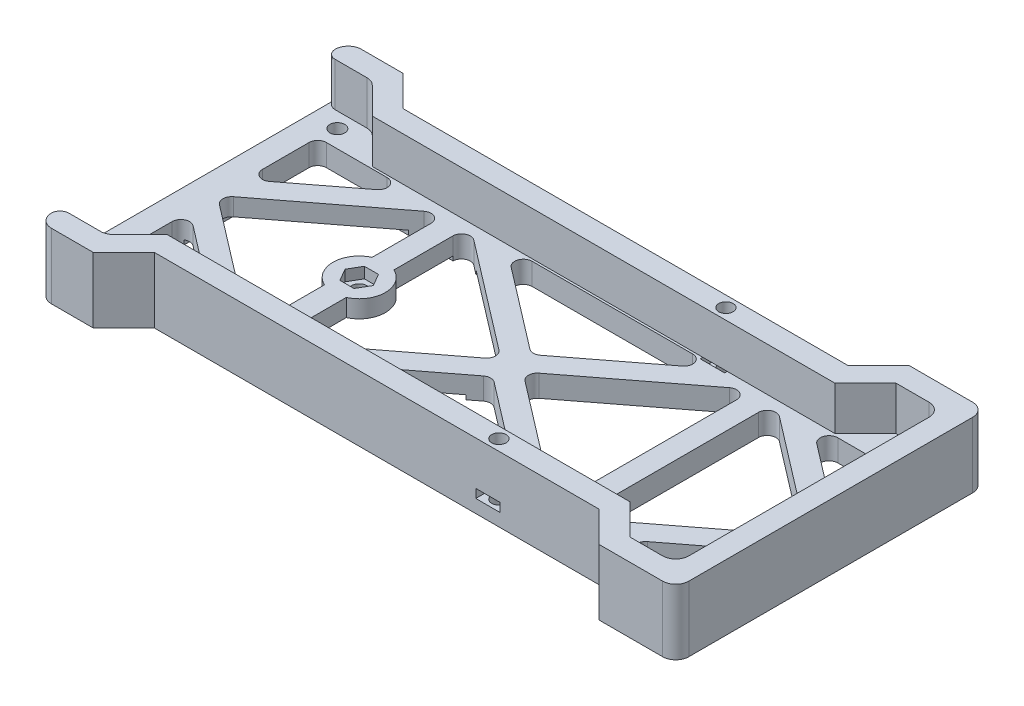
from build123d import *

# Parameters (mm, degrees)
SKETCH1_W                                       = 146
SKETCH1_H                                       = 71
BOSS_EXTRUDE1_DEPTH                             = 15
SHELL1_T                                        = -5
SKETCH2_W                                       = 5
SKETCH2_H                                       = 61
CUT_EXTRUDE1_DEPTH                              = 10
BOSS_EXTRUDE2_DEPTH                             = 10
CSK_FOR_M3_FLAT_HEAD_MACHINE_SCREW1_D           = 3.4
CSK_FOR_M3_FLAT_HEAD_MACHINE_SCREW1_DEPTH       = 10
CSK_FOR_M3_FLAT_HEAD_MACHINE_SCREW1_CSINK_D     = 6.3
CSK_FOR_M3_FLAT_HEAD_MACHINE_SCREW1_CSINK_ANGLE = 90
CSK_FOR_M3_FLAT_HEAD_MACHINE_SCREW1_TIP         = 1.021463052
FILLET1_R                                       = 3
CUT_EXTRUDE3_DEPTH                              = 10
FILLET2_R                                       = 2
SKETCH14_R                                      = 6
BOSS_EXTRUDE4_DEPTH                             = 5
F_3_5_3_5_DIAMETER_HOLE1_D                      = 3.5
CUT_EXTRUDE6_DEPTH                              = 2.5
CUT_EXTRUDE7_DEPTH                              = 10
CUT_EXTRUDE7_DEPTH_BACK                         = 1
SKETCH19_W                                      = 63
SKETCH19_H                                      = 38
CUT_EXTRUDE8_DEPTH                              = 83.54847061
FILLET4_R                                       = 2
FILLET5_R                                       = 3
F_3_3_3_3_DIAMETER_HOLE1_D                      = 3.3
SKETCH24_W                                      = 5.6
SKETCH24_H                                      = 2
CUT_EXTRUDE9_DEPTH                              = 5.6
SKETCH25_W                                      = 5.6
SKETCH25_H                                      = 2
CUT_EXTRUDE10_DEPTH                             = 5.6


with BuildPart() as part:
    # Sketch1 → Boss-Extrude1 (new body)
    with BuildSketch(Plane(origin=(0, 0, 0), x_dir=(1, 0, 0), z_dir=(0, 1, 0))):
        Rectangle(SKETCH1_W, SKETCH1_H)
    extrude(amount=BOSS_EXTRUDE1_DEPTH)

    # Shell1
    shell1_openings = [part.faces().sort_by_distance(p)[0] for p in [
        (0, 15, 0),
    ]]
    offset(amount=SHELL1_T, openings=shell1_openings, kind=Kind.INTERSECTION)

    # Sketch2 → Cut-Extrude1 (cut)
    with BuildSketch(Plane(origin=(0, 15, 0), x_dir=(1, 0, 0), z_dir=(0, 1, 0))):
        with Locations((-70.5, 0)):
            Rectangle(SKETCH2_W, SKETCH2_H)
    extrude(amount=-CUT_EXTRUDE1_DEPTH, mode=Mode.SUBTRACT)

    # Sketch3 → Boss-Extrude2 (add)
    with BuildSketch(Plane(origin=(0, 5, 0), x_dir=(1, 0, 0), z_dir=(0, 1, 0))):
        Polygon((-55.5, 23.5), (50.5, 23.5), (57.5, 30.5), (-62.5, 30.5), align=None)
        Polygon((-55.5, -23.5), (-62.5, -30.5), (57.5, -30.5), (50.5, -23.5), align=None)
    extrude(amount=BOSS_EXTRUDE2_DEPTH)

    # CSK for M3 Flat Head Machine Screw1
    with Locations(Plane(origin=(0, 0, 0), x_dir=(-1, 0, 0), z_dir=(0, -1, 0))):
        with Locations((-63, -27), (67, 27), (67, -27), (-63, 27)):
            CounterSinkHole(CSK_FOR_M3_FLAT_HEAD_MACHINE_SCREW1_D / 2, CSK_FOR_M3_FLAT_HEAD_MACHINE_SCREW1_CSINK_D / 2, depth=CSK_FOR_M3_FLAT_HEAD_MACHINE_SCREW1_DEPTH, counter_sink_angle=CSK_FOR_M3_FLAT_HEAD_MACHINE_SCREW1_CSINK_ANGLE)
            with Locations((0, 0, -(CSK_FOR_M3_FLAT_HEAD_MACHINE_SCREW1_DEPTH + CSK_FOR_M3_FLAT_HEAD_MACHINE_SCREW1_TIP / 2))):  # 118° drill point
                Cone(0, CSK_FOR_M3_FLAT_HEAD_MACHINE_SCREW1_D / 2, CSK_FOR_M3_FLAT_HEAD_MACHINE_SCREW1_TIP, mode=Mode.SUBTRACT)

    # Fillet1
    fillet1_edges = [part.edges().sort_by_distance(p)[0] for p in [
        (-73, 7.5, -35.5),
        (73, 7.5, -35.5),
        (73, 7.5, 35.5),
        (-73, 7.5, 35.5),
    ]]
    fillet(fillet1_edges, radius=FILLET1_R)

    # Sketch8 → Cut-Extrude3 (cut)
    with BuildSketch(Plane.XZ):
        Polygon((67.5, 0), (37.5, 23), (37.5, -23), align=None)
        Polygon((0, 4.383686057), (24.282148621, 23), (-24.282148621, 23), align=None)
        Polygon((2.5, 0), (32.5, -23), (32.5, 23), align=None)
        Polygon((-2.5, 0), (-32.5, 23), (-32.5, -23), align=None)
        Polygon((-67.5, 0), (-37.5, -23), (-37.5, 23), align=None)
        Polygon((-45.717851379, 23), (-67.5, 23), (-67.5, 6.300352724), align=None)
        Polygon((67.5, 6.300352724), (45.717851379, 23), (67.5, 23), align=None)
        Polygon((45.717851379, -23), (67.5, -23), (67.5, -6.300352724), align=None)
        Polygon((-67.5, -6.300352724), (-45.717851379, -23), (-67.5, -23), align=None)
        Polygon((-24.282148621, -23), (24.282148621, -23), (0, -4.383686057), align=None)
    extrude(amount=-CUT_EXTRUDE3_DEPTH, mode=Mode.SUBTRACT)

    # Fillet2
    fillet2_edges = [part.edges().sort_by_distance(p)[0] for p in [
        (-67.5, 2.5, 0),
        (-37.5, 2.5, 23),
        (-37.5, 2.5, -23),
        (0, 2.5, 4.383686057),
        (-24.282148621, 2.5, 23),
        (24.282148621, 2.5, 23),
        (45.717851379, 2.5, -23),
        (67.5, 2.5, -6.300352724),
        (67.5, 2.5, -23),
        (-67.5, 2.5, -23),
        (-67.5, 2.5, -6.300352724),
        (-45.717851379, 2.5, -23),
        (67.5, 2.5, 23),
        (67.5, 2.5, 6.300352724),
        (45.717851379, 2.5, 23),
        (-45.717851379, 2.5, 23),
        (-67.5, 2.5, 6.300352724),
        (-67.5, 2.5, 23),
        (-2.5, 2.5, 0),
        (-32.5, 2.5, -23),
        (-32.5, 2.5, 23),
        (2.5, 2.5, 0),
        (32.5, 2.5, 23),
        (32.5, 2.5, -23),
        (-24.282148621, 2.5, -23),
        (0, 2.5, -4.383686057),
        (24.282148621, 2.5, -23),
        (67.5, 2.5, 0),
        (37.5, 2.5, -23),
        (37.5, 2.5, 23),
    ]]
    fillet(fillet2_edges, radius=FILLET2_R)

    # Sketch14 → Boss-Extrude4 (add, through all)
    with BuildSketch(Plane(origin=(0, 5, 0), x_dir=(1, 0, 0), z_dir=(0, 1, 0))):
        with Locations((-35, 0)):
            Circle(SKETCH14_R)
    extrude(amount=-BOSS_EXTRUDE4_DEPTH)

    # Ø3.5 (3.5) Diameter Hole1 (through all)
    with Locations(Plane(origin=(0, 5, 0), x_dir=(1, 0, 0), z_dir=(0, 1, 0))):
        with Locations((-35, 0)):
            Hole(F_3_5_3_5_DIAMETER_HOLE1_D / 2)

    # Sketch17 → Cut-Extrude6 (cut)
    with BuildSketch(Plane(origin=(0, 5, 0), x_dir=(1, 0, 0), z_dir=(0, 1, 0))):
        Polygon((-31.766838493, 0), (-33.383419246, 2.8), (-36.616580754, 2.8), (-38.233161507, 0), (-36.616580754, -2.8), (-33.383419246, -2.8), align=None)
    extrude(amount=-CUT_EXTRUDE6_DEPTH, mode=Mode.SUBTRACT)

    # Sketch19 → Cut-Extrude7 (cut, two sides: drawn at the far end of the back side and taken through both)
    with BuildSketch(Plane.XZ.offset(-CUT_EXTRUDE7_DEPTH_BACK)):
        with Locations((-35, 0)):
            Rectangle(SKETCH19_W, SKETCH19_H)
    extrude(amount=CUT_EXTRUDE7_DEPTH + CUT_EXTRUDE7_DEPTH_BACK, mode=Mode.SUBTRACT)

    # Sketch20 → Cut-Extrude8 (cut, through all)
    with BuildSketch(Plane(origin=(0, 15, 0), x_dir=(1, 0, 0), z_dir=(0, 1, 0))):
        Polygon((-58.964466094, 34.035533906), (-60.428932188, 35.5), (55.428932188, 35.5), (53.964466094, 34.035533906), (48.428932188, 28.5), (-53.428932188, 28.5), align=None)
        Polygon((-58.964466094, -34.035533906), (-53.428932188, -28.5), (48.428932188, -28.5), (53.964466094, -34.035533906), (55.428932188, -35.5), (-60.428932188, -35.5), align=None)
    extrude(amount=-CUT_EXTRUDE8_DEPTH, mode=Mode.SUBTRACT)

    # Fillet4
    fillet4_edges = [part.edges().sort_by_distance(p)[0] for p in [
        (-73, 10, -30.5),
        (-73, 10, 30.5),
    ]]
    fillet(fillet4_edges, radius=FILLET4_R - 0.0001)  # a hair under: the kernel refuses the full size

    # Fillet5
    fillet5_edges = [part.edges().sort_by_distance(p)[0] for p in [
        (68, 10, 30.5),
        (68, 10, -30.5),
        (-62.5, 10, -30.5),
        (-62.5, 10, 30.5),
    ]]
    fillet(fillet5_edges, radius=FILLET5_R)

    # Ø3.3 (3.3) Diameter Hole1 (through all)
    with Locations(Plane(origin=(0, 0, 0), x_dir=(-1, 0, 0), z_dir=(0, -1, 0))):
        with Locations((-23, 26), (-23, -26)):
            Hole(F_3_3_3_3_DIAMETER_HOLE1_D / 2)

    # Sketch24 → Cut-Extrude9 (cut)
    with BuildSketch(Plane.XY.offset(28.5)):
        with Locations((23, 4)):
            Rectangle(SKETCH24_W, SKETCH24_H)
    extrude(amount=-CUT_EXTRUDE9_DEPTH, mode=Mode.SUBTRACT)

    # Sketch25 → Cut-Extrude10 (cut)
    with BuildSketch(Plane(origin=(0, 0, -28.5), x_dir=(-1, 0, 0), z_dir=(0, 0, -1))):
        with Locations((-23, 4)):
            Rectangle(SKETCH25_W, SKETCH25_H)
    extrude(amount=-CUT_EXTRUDE10_DEPTH, mode=Mode.SUBTRACT)


solid = part.part
